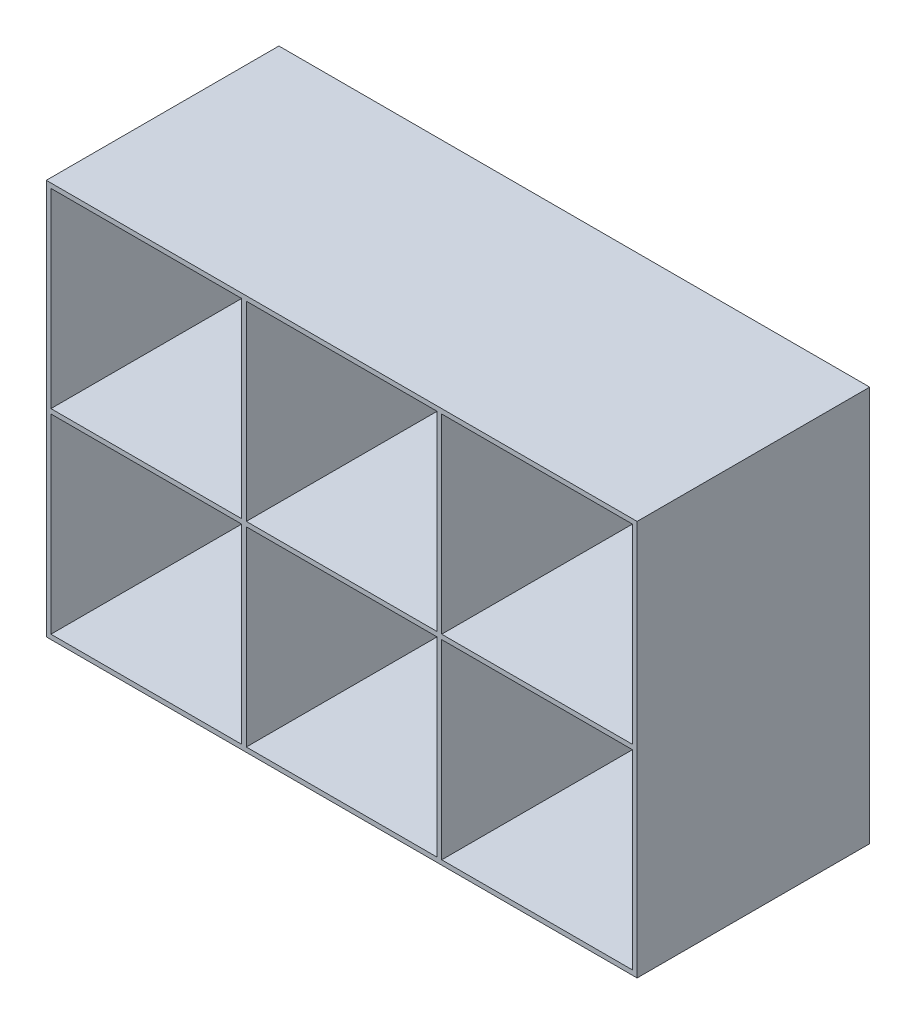
from build123d import *

# Parameters (mm, degrees)
SKETCH_1_W      = 63.5
SKETCH_1_H      = 42.5
SKETCH_1_W_2    = 20.5
SKETCH_1_H_2    = 20.5
EXTRUDE_1_DEPTH = 25


with BuildPart() as part:
    # ｽｹｯﾁ1 → ﾎﾞｽ - 押し出し1 (new body)
    with BuildSketch(Plane.XY):
        with Locations((-53.634838442, 38.923989141)):
            Rectangle(SKETCH_1_W, SKETCH_1_H)
        with Locations((-53.634838442, 28.423989141)):
            Rectangle(SKETCH_1_W_2, SKETCH_1_H_2, mode=Mode.SUBTRACT)
        with Locations((-74.634838442, 28.423989141)):
            Rectangle(SKETCH_1_W_2, SKETCH_1_H_2, mode=Mode.SUBTRACT)
        with Locations((-32.634838442, 28.423989141)):
            Rectangle(SKETCH_1_W_2, SKETCH_1_H_2, mode=Mode.SUBTRACT)
        with Locations((-53.634838442, 49.423989141)):
            Rectangle(SKETCH_1_W_2, SKETCH_1_H_2, mode=Mode.SUBTRACT)
        with Locations((-32.634838442, 49.423989141)):
            Rectangle(SKETCH_1_W_2, SKETCH_1_H_2, mode=Mode.SUBTRACT)
        with Locations((-74.634838442, 49.423989141)):
            Rectangle(SKETCH_1_W_2, SKETCH_1_H_2, mode=Mode.SUBTRACT)
    extrude(amount=EXTRUDE_1_DEPTH)


solid = part.part
